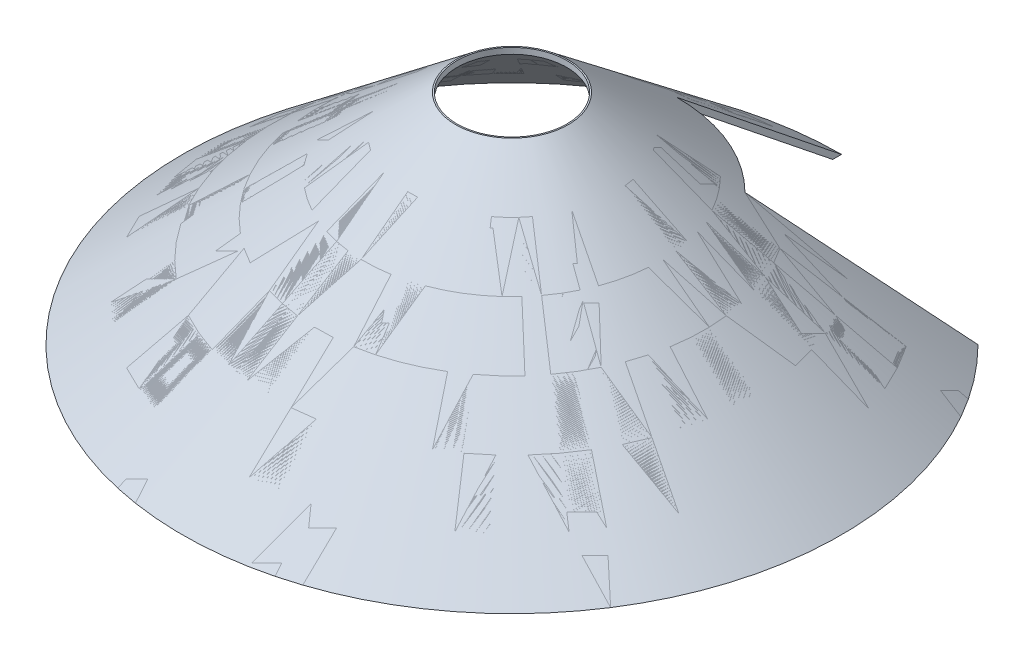
from build123d import *

# Parameters (mm, degrees)
CUT_EXTRUDE1_DEPTH = 76.2
CUT_EXTRUDE2_DEPTH = 0.254


# Read off the part's stored shape, not the designer's step: Revolve2
with BuildPart() as part:
    # Revolve2 outline → Revolve2 (revolve)
    with BuildSketch(Plane.XY):
        Polygon((12.7, 49.173606444), (74.167008055, 0), (76.2, 0), (12.7, 50.8), align=None)
    revolve(axis=Axis((0, 0, 0), (0, 1, 0)))


with BuildPart() as body_2:
    # Revolve2 2 outline → Revolve2 2 (revolve)
    with BuildSketch(Plane.XY):
        Polygon((12.7, 50.8), (12.7, 49.173606444), (74.167008055, 0), (76.2, 0), align=None)
    revolve(axis=Axis((0, 0, 0), (0, 1, 0)))


with BuildPart() as cut_extrude1_tool:
    # Sketch2 → Cut-Extrude1 (new, symmetric)
    with BuildSketch(Plane(origin=(0, 0, 0), x_dir=(1, 0, 0), z_dir=(0, 1, 0))):
        with BuildLine():
            Line((0, 38.1), (0, 76.2))
            ThreePointArc((0, 76.2), (29.160477546, 70.399620377), (53.881536726, 53.881536726))
            Line((53.881536726, 53.881536726), (26.940768363, 26.940768363))
            ThreePointArc((26.940768363, 26.940768363), (14.580238773, 35.199810189), (0, 38.1))
        make_face()
    extrude(amount=CUT_EXTRUDE1_DEPTH, both=True)


with BuildPart() as part_1:
    add(part.part)

    # Cut-Extrude1: cut by cut_extrude1_tool
    add(cut_extrude1_tool.part, mode=Mode.SUBTRACT)


with BuildPart() as body_2_1:
    add(body_2.part)

    # Cut-Extrude1: cut by cut_extrude1_tool
    add(cut_extrude1_tool.part, mode=Mode.SUBTRACT)


with BuildPart() as cut_extrude2_tool:
    # 3DSketch1 → Cut-Extrude2 (new body)
    with BuildSketch(Plane(origin=(-15.875, 50.8, 15.875), x_dir=(0.7071067811865501, 2.4725865491083076e-15, -0.7071067811865451), z_dir=(0, -1, 0))):
        Polygon((0, 0), (22.450640303, 22.450640303), (44.901280605, 0), (22.450640303, -22.450640303), align=None)
    extrude(amount=CUT_EXTRUDE2_DEPTH)


with BuildPart() as part_2:
    add(part_1.part)

    # Cut-Extrude2: cut by cut_extrude2_tool
    add(cut_extrude2_tool.part, mode=Mode.SUBTRACT)


with BuildPart() as body_2_2:
    add(body_2_1.part)

    # Cut-Extrude2: cut by cut_extrude2_tool
    add(cut_extrude2_tool.part, mode=Mode.SUBTRACT)


solid = Compound([part_2.part, body_2_2.part])
